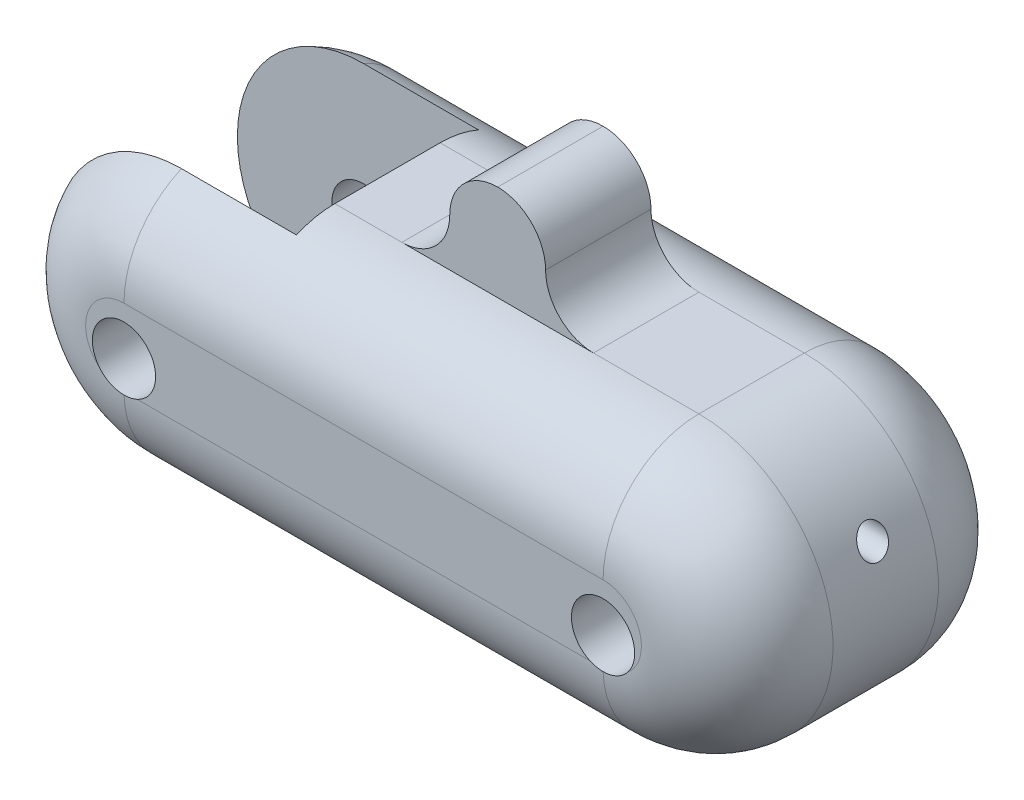
from build123d import *

# Parameters (mm, degrees)
BOSS_EXTRUDE1_DEPTH = 15.5
FILLET1_R           = 5
SKETCH5_W           = 13
SKETCH5_H           = 9.5
CUT_EXTRUDE3_DEPTH  = 36.29164207
SKETCH6_W           = 5
SKETCH6_H           = 5.5
BOSS_EXTRUDE2_DEPTH = 5
FILLET2_R           = 2.5
FILLET3_R           = 2.5
SKETCH3_R           = 1.65
CUT_EXTRUDE4_DEPTH  = 29.574464179
SKETCH8_R           = 0.75
CUT_EXTRUDE7_DEPTH  = 44.873285276
SKETCH9_R           = 0.75
CUT_EXTRUDE9_DEPTH  = 17.215351852


with BuildPart() as part:
    # Sketch2 → Boss-Extrude1 (new body)
    with BuildSketch(Plane.XY):
        with BuildLine():
            Line((-12.5, 0), (12.5, 0))
            ThreePointArc((12.5, 0), (19.5, -7), (12.5, -14))
            Line((12.5, -14), (-12.5, -14))
            ThreePointArc((-12.5, -14), (-19.5, -7), (-12.5, 0))
        make_face()
    extrude(amount=BOSS_EXTRUDE1_DEPTH)

    # Fillet1
    fillet1_edges = [part.edges().sort_by_distance(p)[0] for p in [
        (-19.5, -7, 15.5),
        (0, -14, 15.5),
        (19.5, -7, 15.5),
        (0, -14, 0),
        (-19.5, -7, 0),
        (0, 0, 0),
        (19.5, -7, 0),
        (0, 0, 15.5),
    ]]
    fillet(fillet1_edges, radius=FILLET1_R)

    # Sketch5 → Cut-Extrude3 (cut, through all)
    with BuildSketch(Plane(origin=(0, -25, 0), x_dir=(-1, 0, 0), z_dir=(0, -1, 0))):
        with Locations((13, -7.75)):
            Rectangle(SKETCH5_W, SKETCH5_H)
    extrude(amount=-CUT_EXTRUDE3_DEPTH, mode=Mode.SUBTRACT)

    # Sketch6 → Boss-Extrude2 (add)
    with BuildSketch(Plane(origin=(0, 0, 0), x_dir=(1, 0, 0), z_dir=(0, 1, 0))):
        with Locations((2, -7.75)):
            Rectangle(SKETCH6_W, SKETCH6_H)
    extrude(amount=BOSS_EXTRUDE2_DEPTH)

    # Fillet2
    fillet2_edges = [part.edges().sort_by_distance(p)[0] for p in [
        (4.5, 5, 7.75),
        (-0.5, 5, 7.75),
    ]]
    fillet(fillet2_edges, radius=FILLET2_R - 0.0001)  # a hair under: the kernel refuses the full size

    # Fillet3
    fillet3_edges = [part.edges().sort_by_distance(p)[0] for p in [
        (-0.5, 0, 7.75),
        (4.5, 0, 7.75),
    ]]
    fillet(fillet3_edges, radius=FILLET3_R)

    # Sketch3 → Cut-Extrude4 (cut, through all)
    with BuildSketch(Plane.XY.offset(15.5)):
        with Locations((-12.5, -7.5)):
            Circle(SKETCH3_R)
        with Locations(Location((12.5, -7.5, 0), (0, 0, 321.484430951))):
            Circle(SKETCH3_R)
    extrude(amount=-CUT_EXTRUDE4_DEPTH, mode=Mode.SUBTRACT)

    # Sketch8 → Cut-Extrude7 (cut, through all)
    with BuildSketch(Plane(origin=(19.5, 0, 0), x_dir=(0, 0, -1), z_dir=(1, 0, 0))):
        with Locations((-7.75, -4)):
            Circle(SKETCH8_R)
    extrude(amount=-CUT_EXTRUDE7_DEPTH, mode=Mode.SUBTRACT)

    # Sketch9 → Cut-Extrude9 (cut, along a direction that is not the sketch's normal)
    with BuildSketch(Plane.ZY.offset(6.5)):
        with Locations((7.75, -10)):
            Circle(SKETCH9_R)
    extrude(amount=-CUT_EXTRUDE9_DEPTH, dir=(-0.9294030199155335, 0.36906642569039866, 0), mode=Mode.SUBTRACT)


solid = part.part
